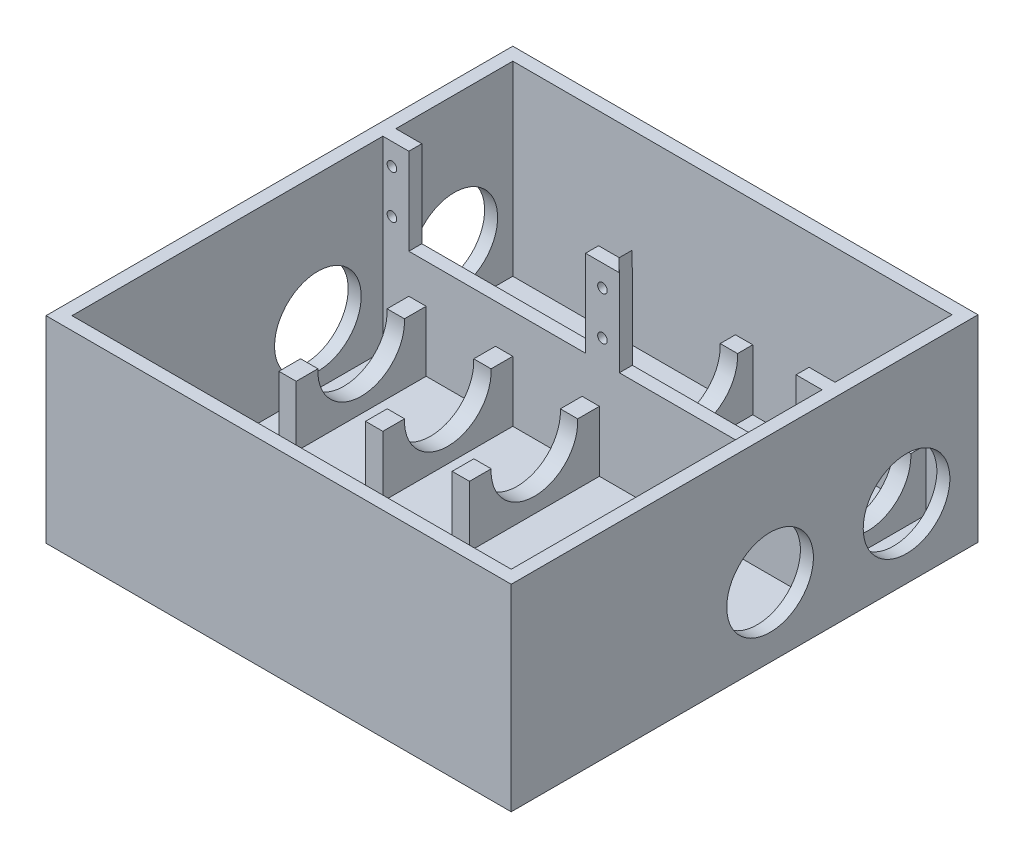
from build123d import *

# Parameters (mm, degrees)
SKETCH3_W           = 107.4
SKETCH3_H           = 136.761182254
BOSS_EXTRUDE2_DEPTH = 2.5
SKETCH4_W           = 4
SKETCH4_H           = 30
BOSS_EXTRUDE3_DEPTH = 14
BOSS_EXTRUDE5_DEPTH = 26
SKETCH8_R           = 1
CUT_EXTRUDE3_DEPTH  = 176.824858798
SKETCH10_W          = 101.4
SKETCH10_H          = 3
BOSS_EXTRUDE6_DEPTH = 46
SKETCH14_W          = 107.4
SKETCH14_H          = 29
CUT_EXTRUDE7_DEPTH  = 181.528753863
SKETCH15_W          = 40.8
SKETCH15_H          = 23
SKETCH15_R          = 1.103593158
CUT_EXTRUDE11_DEPTH = 14
SKETCH17_R          = 10
CUT_EXTRUDE12_DEPTH = 160.685573552
SKETCH18_W          = 101.4
SKETCH18_H          = 3
BOSS_EXTRUDE7_DEPTH = 26
SKETCH19_W          = 4
SKETCH19_H          = 3
SKETCH19_H_2        = 3.000000485
BOSS_EXTRUDE8_DEPTH = 12
SKETCH20_W          = 6
SKETCH20_H          = 3
SKETCH20_W_2        = 7.776734501
CUT_EXTRUDE13_DEPTH = 3
SKETCH21_W          = 107.4
SKETCH21_H          = 107.761182254
SKETCH21_W_2        = 101.4
SKETCH21_H_2        = 101.761182254
BOSS_EXTRUDE9_DEPTH = 17


with BuildPart() as part:
    # Sketch3 → Boss-Extrude2 (new body)
    with BuildSketch(Plane(origin=(0, 0, 0), x_dir=(1, 0, 0), z_dir=(0, 1, 0))):
        with Locations((-53.7, -68.380591127)):
            Rectangle(SKETCH3_W, SKETCH3_H)
    extrude(amount=BOSS_EXTRUDE2_DEPTH)

    # Sketch4 → Boss-Extrude3 (add)
    with BuildSketch(Plane(origin=(0, 2.5, 0), x_dir=(1, 0, 0), z_dir=(0, 1, 0))):
        with Locations((-31, -14.999999758)):
            Rectangle(SKETCH4_W, SKETCH4_H)
        with Locations((-51, -15)):
            Rectangle(SKETCH4_W, SKETCH4_H)
        with Locations((-11, -14.999999515)):
            Rectangle(SKETCH4_W, SKETCH4_H)
        with Locations((-76.4, -48.000000242)):
            Rectangle(SKETCH4_W, SKETCH4_H)
        with Locations((-96.4, -48.000000485)):
            Rectangle(SKETCH4_W, SKETCH4_H)
        with Locations((-56.4, -48)):
            Rectangle(SKETCH4_W, SKETCH4_H)
    extrude(amount=BOSS_EXTRUDE3_DEPTH)

    # Sketch7 → Boss-Extrude5 (add)
    with BuildSketch(Plane(origin=(0, 2.5, 0), x_dir=(1, 0, 0), z_dir=(0, 1, 0))):
        Polygon((-9, -3), (-3, -3), (-3, -133.761182254), (-104.4, -133.761182254), (-104.4, -3), (-53, -3), (-53, 0), (-107.4, 0), (-107.4, -136.761182254), (0, -136.761182254), (0, 0), (-9, 0), align=None)
        Polygon((-28.999999909, -3), (-12.999999909, -2.999999515), (-13, 4.85e-07), (-29, 0), align=None)
        Polygon((-48.999999955, -3), (-32.999999955, -2.999999758), (-33, 2.42e-07), (-49, 0), align=None)
    extrude(amount=BOSS_EXTRUDE5_DEPTH)

    # Sketch8 → Cut-Extrude3 (cut, through all)
    with BuildSketch(Plane(origin=(0, 2.5, 0), x_dir=(1, 0, 0), z_dir=(0, 1, 0))):
        with Locations((-72.4, -69.000000485)):
            Circle(SKETCH8_R)
        with Locations((-26.68, -69.000000485)):
            Circle(SKETCH8_R)
        with Locations((-26.68, -84.240000485)):
            Circle(SKETCH8_R)
        with Locations((-72.4, -84.240000485)):
            Circle(SKETCH8_R)
    extrude(amount=-CUT_EXTRUDE3_DEPTH, mode=Mode.SUBTRACT)


with BuildPart() as boss_extrude6_tool:
    # Sketch10 → Boss-Extrude6 (new body)
    with BuildSketch(Plane(origin=(0, 2.5, 0), x_dir=(1, 0, 0), z_dir=(0, 1, 0))):
        with Locations((-53.7, -31.499999515)):
            Rectangle(SKETCH10_W, SKETCH10_H)
    extrude(amount=BOSS_EXTRUDE6_DEPTH)


with BuildPart() as part_1:
    add(part.part)


with BuildPart() as part_2:
    # Boss-Extrude6: joined with boss_extrude6_tool
    add(part_1.part.fuse(boss_extrude6_tool.part, tol=0.00001))

    # Sketch14 → Cut-Extrude7 (cut, through all)
    with BuildSketch(Plane.XZ):
        with Locations((-53.7, 122.261182254)):
            Rectangle(SKETCH14_W, SKETCH14_H)
    extrude(amount=-CUT_EXTRUDE7_DEPTH, mode=Mode.SUBTRACT)

    # Sketch15 → Cut-Extrude11 (cut)
    with BuildSketch(Plane.XY.offset(32.999999515)):
        with Locations((-78, 37)):
            Rectangle(SKETCH15_W, SKETCH15_H)
        Polygon((-49.823265499, 48.5), (-49.8, 25.5), (-9, 25.5), (-9, 48.5), align=None)
        with Locations((-102.3, 30.5)):
            Circle(SKETCH15_R)
        with Locations((-102.3, 40.5)):
            Circle(SKETCH15_R)
        with Locations((-53.7, 30.5)):
            Circle(SKETCH15_R)
        with Locations((-53.7, 40.5)):
            Circle(SKETCH15_R)
        with Locations((-5.1, 40.5)):
            Circle(SKETCH15_R)
        with Locations((-5.1, 30.5)):
            Circle(SKETCH15_R)
    extrude(amount=-CUT_EXTRUDE11_DEPTH, mode=Mode.SUBTRACT)

    # Sketch17 → Cut-Extrude12 (cut, through all)
    with BuildSketch(Plane.ZY.offset(107.4)):
        with Locations((16.5, 16)):
            Circle(SKETCH17_R)
        with Locations((48, 16)):
            Circle(SKETCH17_R)
    extrude(amount=-CUT_EXTRUDE12_DEPTH, mode=Mode.SUBTRACT)

    # Sketch18 → Boss-Extrude7 (add)
    with BuildSketch(Plane(origin=(0, 2.5, 0), x_dir=(1, 0, 0), z_dir=(0, 1, 0))):
        with Locations((-53.7, -106.261182254)):
            Rectangle(SKETCH18_W, SKETCH18_H)
    extrude(amount=BOSS_EXTRUDE7_DEPTH)

    # Sketch19 → Boss-Extrude8 (add)
    with BuildSketch(Plane(origin=(0, 16.5, 0), x_dir=(1, 0, 0), z_dir=(0, 1, 0))):
        with Locations((-51, -1.5)):
            Rectangle(SKETCH19_W, SKETCH19_H)
        with Locations((-31, -1.5)):
            Rectangle(SKETCH19_W, SKETCH19_H)
        with Locations((-11, -1.499999757)):
            Rectangle(SKETCH19_W, SKETCH19_H_2)
    extrude(amount=BOSS_EXTRUDE8_DEPTH)

    # Sketch20 → Cut-Extrude13 (cut)
    with BuildSketch(Plane(origin=(0, 48.5, 0), x_dir=(1, 0, 0), z_dir=(0, 1, 0))):
        with Locations((-6, -31.499999515)):
            Rectangle(SKETCH20_W, SKETCH20_H)
        with Locations((-53.711632749, -31.499999515)):
            Rectangle(SKETCH20_W_2, SKETCH20_H)
        with Locations((-101.4, -31.499999515)):
            Rectangle(SKETCH20_W, SKETCH20_H)
    extrude(amount=-CUT_EXTRUDE13_DEPTH, mode=Mode.SUBTRACT)

    # Sketch21 → Boss-Extrude9 (add)
    with BuildSketch(Plane(origin=(0, 28.5, 0), x_dir=(1, 0, 0), z_dir=(0, 1, 0))):
        with Locations((-53.7, -53.880591127)):
            Rectangle(SKETCH21_W, SKETCH21_H)
        with Locations((-53.7, -53.880591127)):
            Rectangle(SKETCH21_W_2, SKETCH21_H_2, mode=Mode.SUBTRACT)
    extrude(amount=BOSS_EXTRUDE9_DEPTH)


solid = part_2.part
